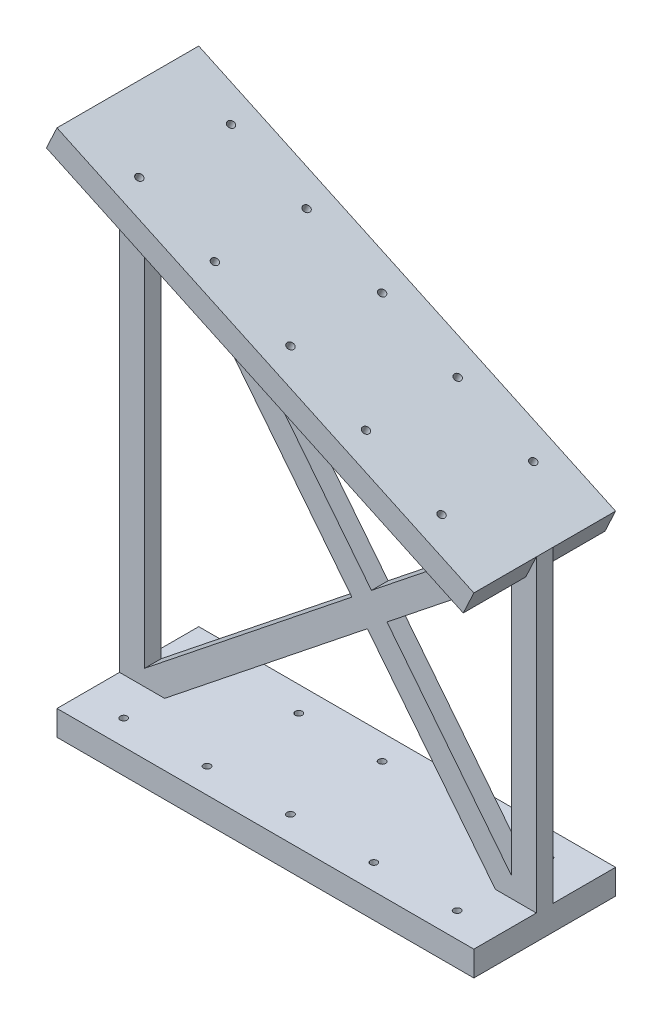
from build123d import *

# Parameters (mm, degrees)
EXTRUDE_1_DEPTH            = 10
SKETCH_3_W                 = 250
SKETCH_3_H                 = 25
EXTRUDE_3_DEPTH            = 15
SKETCH_4_W                 = 275.84447974
SKETCH_4_H                 = 25
EXTRUDE_4_DEPTH            = 15
SKETCH_10_W                = 250
SKETCH_10_H                = 30
EXTRUDE_5_DEPTH            = 15
SKETCH_11_W                = 275.84447974
SKETCH_11_H                = 30
EXTRUDE_6_DEPTH            = 15
HOLE_WIZARD_M5_1_D         = 4.2
HOLE_WIZARD_M5_1_DEPTH     = 15
PATTERN_LINEAR_1_COUNT     = 5
PATTERN_LINEAR_1_PITCH     = 50
MIRROR_1_COPY_1_D          = 4.2
MIRROR_1_COPY_1_DEPTH      = 15
MIRROR_1_COPY_2_D          = 4.2
MIRROR_1_COPY_2_DEPTH      = 15
MIRROR_1_COPY_3_D          = 4.2
MIRROR_1_COPY_3_DEPTH      = 15
MIRROR_1_COPY_4_D          = 4.2
MIRROR_1_COPY_4_DEPTH      = 15
HOLE_WIZARD_M5_2_D         = 4.2
PATTERN_START              = 218.95644092
PATTERN_LINEAR_2_OUTLINE_R = 2.1
PATTERN_LINEAR_2_DEPTH     = 15
HOLE_WIZARD_M5_3_D         = 4.2
PATTERN_LINEAR_3_OUTLINE_R = 2.1
PATTERN_LINEAR_3_DEPTH     = 15


# Read off the part's stored shape, not the designer's step: 阵列(线性)2, 阵列(线性)3
with BuildPart() as part:
    # 草图1 → 凸台-拉伸1 (new body)
    with BuildSketch(Plane.XY):
        Polygon((-125.313283208, 0), (124.686716792, 0), (124.686716792, 200), (-125.313283208, 316.576914539), align=None)
        Polygon((-110.313283208, 24.592855818), (-110.313283208, 280.944896886), (14.053831361, 123.772207379), (-107.63654934, 26.72747742), align=None, mode=Mode.SUBTRACT)
        Polygon((23.361623829, 112.009204107), (100.122763689, 15), (-98.284208811, 15), align=None, mode=Mode.SUBTRACT)
        Polygon((109.686716792, 180.85109027), (109.686716792, 27.086733996), (35.089185859, 121.36161211), align=None, mode=Mode.SUBTRACT)
        Polygon((-95.156980934, 285.964131062), (102.096111819, 193.983503317), (100.334376264, 192.57856769), (25.781393391, 133.124615382), align=None, mode=Mode.SUBTRACT)
    extrude(amount=EXTRUDE_1_DEPTH)

    # 草图3 → 凸台-拉伸3 (add)
    with BuildSketch(Plane.XZ):
        with Locations((-0.313283208, 5)):
            Rectangle(SKETCH_3_W, SKETCH_3_H)
    extrude(amount=-EXTRUDE_3_DEPTH)

    # 草图4 → 凸台-拉伸4 (add)
    with BuildSketch(Plane(origin=(98.874264385, 212.036544233, 0), x_dir=(0.9063077870366497, -0.4226182617407002, 0), z_dir=(0.42261826174070016, 0.9063077870366496, 0))):
        with Locations((-109.44134985, -5)):
            Rectangle(SKETCH_4_W, SKETCH_4_H)
    extrude(amount=-EXTRUDE_4_DEPTH)

    # 草图10 → 凸台-拉伸5 (add)
    with BuildSketch(Plane.XZ):
        with Locations((-0.313283208, 32.5)):
            Rectangle(SKETCH_10_W, SKETCH_10_H)
        with Locations((-0.313283208, -22.5)):
            Rectangle(SKETCH_10_W, SKETCH_10_H)
    extrude(amount=-EXTRUDE_5_DEPTH)

    # 草图11 → 凸台-拉伸6 (add)
    with BuildSketch(Plane(origin=(98.874264385, 212.036544233, 0), x_dir=(0.9063077870366497, -0.4226182617407002, 0), z_dir=(0.42261826174070016, 0.9063077870366496, 0))):
        with Locations((-109.44134985, 22.5)):
            Rectangle(SKETCH_11_W, SKETCH_11_H)
        with Locations((-109.44134985, -32.5)):
            Rectangle(SKETCH_11_W, SKETCH_11_H)
    extrude(amount=-EXTRUDE_6_DEPTH)

    # M5 螺纹孔1
    with Locations(Plane(origin=(-100.313283208, 15, 32.5), x_dir=(0, 0, 1), z_dir=(0, 1, 0))):
        with Locations((0, 0)):
            hole_wizard_m5_1 = Hole(HOLE_WIZARD_M5_1_D / 2, depth=HOLE_WIZARD_M5_1_DEPTH)

    # 阵列(线性)1: M5 螺纹孔1 ×5
    with Locations(*[(i * PATTERN_LINEAR_1_PITCH, 0, 0) for i in range(1, PATTERN_LINEAR_1_COUNT)]):
        add(hole_wizard_m5_1, mode=Mode.SUBTRACT)

    # 镜向1: M5 螺纹孔1 across plane
    add(hole_wizard_m5_1.mirror(Plane(origin=(0, 0, 5), x_dir=(1, 0, 0), z_dir=(0, 0, -1))), mode=Mode.SUBTRACT)

    # 镜向1 copy 1
    with Locations(Plane(origin=(-50.313283208, 15, -22.5), x_dir=(0, 0, -1), z_dir=(0, 1, 0))):
        with Locations((0, 0)):
            Hole(MIRROR_1_COPY_1_D / 2, depth=MIRROR_1_COPY_1_DEPTH)

    # 镜向1 copy 2
    with Locations(Plane(origin=(-0.313283208, 15, -22.5), x_dir=(0, 0, -1), z_dir=(0, 1, 0))):
        with Locations((0, 0)):
            Hole(MIRROR_1_COPY_2_D / 2, depth=MIRROR_1_COPY_2_DEPTH)

    # 镜向1 copy 3
    with Locations(Plane(origin=(49.686716792, 15, -22.5), x_dir=(0, 0, -1), z_dir=(0, 1, 0))):
        with Locations((0, 0)):
            Hole(MIRROR_1_COPY_3_D / 2, depth=MIRROR_1_COPY_3_DEPTH)

    # 镜向1 copy 4
    with Locations(Plane(origin=(99.686716792, 15, -22.5), x_dir=(0, 0, -1), z_dir=(0, 1, 0))):
        with Locations((0, 0)):
            Hole(MIRROR_1_COPY_4_D / 2, depth=MIRROR_1_COPY_4_DEPTH)

    # M5 螺纹孔2 (through all)
    with Locations(Plane(origin=(-90.944061912, 300.550283443, -22.5), x_dir=(0.906307787037, -0.422618261741, 0), z_dir=(0.422618261741, 0.906307787037, 0))):
        with Locations((0, 0)):
            Hole(HOLE_WIZARD_M5_2_D / 2)

    # 阵列(线性)2 outline → 阵列(线性)2 (cut)
    with BuildSketch(Plane(origin=(0, 0, 0), x_dir=(0.9063077870366497, -0.42261826174069983, 0), z_dir=(0.4226182617406999, 0.9063077870366498, 0)).offset(PATTERN_START)):
        with Locations((-159.44134985, 22.5)):
            Circle(PATTERN_LINEAR_2_OUTLINE_R)
        with Locations((-109.44134985, 22.5)):
            Circle(PATTERN_LINEAR_2_OUTLINE_R)
        with Locations((-59.44134985, 22.5)):
            Circle(PATTERN_LINEAR_2_OUTLINE_R)
        with Locations((-9.44134985, 22.5)):
            Circle(PATTERN_LINEAR_2_OUTLINE_R)
    extrude(amount=PATTERN_LINEAR_2_DEPTH, mode=Mode.SUBTRACT)

    # M5 螺纹孔3 (through all)
    with Locations(Plane(origin=(-90.944061912, 300.550283443, 32.5), x_dir=(0.906307787037, -0.422618261741, 0), z_dir=(0.422618261741, 0.906307787037, 0))):
        with Locations((0, 0)):
            Hole(HOLE_WIZARD_M5_3_D / 2)

    # 阵列(线性)3 outline → 阵列(线性)3 (cut)
    with BuildSketch(Plane(origin=(0, 0, 0), x_dir=(0.9063077870366497, -0.42261826174069983, 0), z_dir=(0.4226182617406999, 0.9063077870366498, 0)).offset(PATTERN_START)):
        with Locations((-159.44134985, -32.5)):
            Circle(PATTERN_LINEAR_3_OUTLINE_R)
        with Locations((-109.44134985, -32.5)):
            Circle(PATTERN_LINEAR_3_OUTLINE_R)
        with Locations((-59.44134985, -32.5)):
            Circle(PATTERN_LINEAR_3_OUTLINE_R)
        with Locations((-9.44134985, -32.5)):
            Circle(PATTERN_LINEAR_3_OUTLINE_R)
    extrude(amount=PATTERN_LINEAR_3_DEPTH, mode=Mode.SUBTRACT)


solid = part.part
